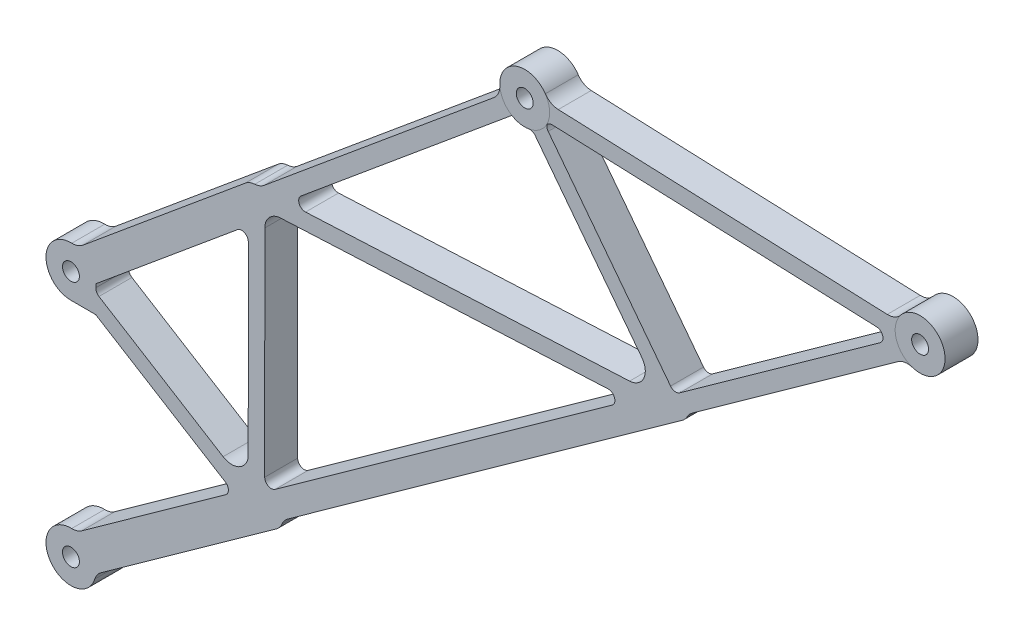
from build123d import *

# Parameters (mm, degrees)
SKETCH1_R           = 3.2639
BOSS_EXTRUDE1_DEPTH = 6.35
FILLET2_R           = 6.35
FILLET3_R           = 2.54
FILLET6_R           = 6.35
FILLET7_R           = 6.35


with BuildPart() as part:
    # Sketch1 → Boss-Extrude1 (new, symmetric)
    with BuildSketch(Plane.XY):
        with BuildLine():
            ThreePointArc((1657.362226857, -25.665303386), (1645.082138382, -19.376819434), (1639.161234094, -31.838299916))
            Line((1639.161234094, -31.838299916), (1543.928298612, -110.961407638))
            Line((1543.928298612, -110.961407638), (1542.386268966, -109.105413681))
            Line((1542.386268966, -109.105413681), (1475.716388889, -164.497259751))
            ThreePointArc((1475.716388889, -164.497259751), (1463.735668917, -172.561408735), (1473.270132637, -183.40862734))
            Line((1473.270132637, -183.40862734), (1482.795132637, -183.40862734))
            Line((1482.795132637, -183.40862734), (1536.006430236, -216.269775409))
            Line((1536.006430236, -216.269775409), (1475.438186342, -259.678478553))
            ThreePointArc((1475.438186342, -259.678478553), (1465.455879345, -274.64513078), (1482.83634148, -270.00113812))
            Line((1482.83634148, -270.00113812), (1554.239311773, -218.827286252))
            Line((1554.239311773, -218.827286252), (1553.129588502, -217.278887316))
            Line((1553.129588502, -217.278887316), (1710.323691942, -104.61931964))
            Line((1710.323691942, -104.61931964), (1709.583876428, -103.587053683))
            Line((1709.583876428, -103.587053683), (1795.041714347, -42.340207499))
            ThreePointArc((1795.041714347, -42.340207499), (1809.776954687, -31.712536315), (1791.625246623, -30.944293485))
            Line((1791.625246623, -30.944293485), (1657.362226857, -25.665303386))
        make_face()
        with BuildLine():
            Line((1700.720652168, -102.126820321), (1556.109252329, -109.096723899))
            Line((1556.109252329, -109.096723899), (1643.219206848, -36.72249454))
            ThreePointArc((1643.219206848, -36.72249454), (1647.101886478, -38.035715693), (1651.178708707, -37.612311142))
            Line((1651.178708707, -37.612311142), (1700.720652168, -102.126820321))
        make_face(mode=Mode.SUBTRACT)
        with BuildLine():
            ThreePointArc((1482.659265028, -175.861431519), (1482.859244436, -174.484660756), (1482.858420935, -173.093442291))
            Line((1482.858420935, -173.093442291), (1541.633109373, -124.261218638))
            Line((1541.633109373, -124.261218638), (1541.60005002, -212.260879574))
            Line((1541.60005002, -212.260879574), (1482.659265028, -175.861431519))
        make_face(mode=Mode.SUBTRACT)
        with Locations((1473.270132637, -269.04472734)):
            Circle(SKETCH1_R, mode=Mode.SUBTRACT)
        with Locations((1473.270132637, -173.79472734)):
            Circle(SKETCH1_R, mode=Mode.SUBTRACT)
        Polygon((1547.986271365, -115.845602263), (1688.873329523, -109.05520253), (1547.950879905, -210.053025619), align=None, mode=Mode.SUBTRACT)
        with Locations((1648.169999473, -28.481334088)):
            Circle(SKETCH1_R, mode=Mode.SUBTRACT)
        with BuildLine():
            Line((1705.884798859, -98.425723899), (1656.215061092, -33.744798419))
            ThreePointArc((1656.215061092, -33.744798419), (1656.708059099, -32.900452896), (1657.112748585, -32.010400752))
            Line((1657.112748585, -32.010400752), (1791.19818023, -37.282408394))
            Line((1791.19818023, -37.282408394), (1705.884798859, -98.425723899))
        make_face(mode=Mode.SUBTRACT)
        with Locations((1800.567995736, -34.473360149)):
            Circle(SKETCH1_R, mode=Mode.SUBTRACT)
    extrude(amount=BOSS_EXTRUDE1_DEPTH, both=True)

    # Fillet2
    fillet2_edges = [part.edges().sort_by_distance(p)[0] for p in [
        (1541.60005002, -212.260879574, 0),
        (1547.986271365, -115.845602263, 0),
        (1700.720652168, -102.126820321, 0),
        (1791.625246623, -30.944293485, 0),
        (1795.041714347, -42.340207499, 0),
        (1482.83634148, -270.00113812, 0),
        (1475.438186342, -259.678478553, 0),
        (1475.716388889, -164.497259751, 0),
        (1639.161234094, -31.838299916, 0),
        (1657.362226857, -25.665303386, 0),
    ]]
    fillet(fillet2_edges, radius=FILLET2_R)

    # Fillet3
    # the kernel refuses this fillet: 2.54 mm, written as the material it adds along each edge
    with BuildSketch(Plane(origin=(1482.659265028, -175.861431519, -6.35), x_dir=(0.8508312617816599, -0.5254390202250196, 0), z_dir=(0, 0, 1)), Plane(origin=(1656.215061092, -33.744798419, -6.35), x_dir=(0.6090571217254737, -0.7931263597154502, 0), z_dir=(0, 0, 1))) as fillet3_piece_1:
        with BuildLine():
            CenterArc((1.651924419, 2.54), FILLET3_R, 208.048541525, 61.951458475)
            ThreePointArc((-0.5897514, 1.345642633), (-0.269132792, 0.684103596), (0, 0))
            Line((0, 0), (1.651924419, 0))
        make_face()
    extrude(amount=12.7)
    with BuildSketch(Plane(origin=(1541.633109373, -124.261218638, -6.35), x_dir=(-0.00037567588921249087, -0.9999999294338106, 0), z_dir=(0, 0, 1))) as fillet3_piece_2:
        with BuildLine():
            CenterArc((FILLET3_R * 2.13199085195, -FILLET3_R), FILLET3_R, 90, 129.742603087)
            Line((FILLET3_R * 1.36306647439, -FILLET3_R * 1.63933973879), (0, 0))
            Line((0, 0), (FILLET3_R * 2.13199085195, 0))
        make_face()
    extrude(amount=12.7)
    with BuildSketch(Plane(origin=(1547.950879905, -210.053025619, 6.35), x_dir=(0.8128078399508512, 0.5825319006839296, 0), z_dir=(0, 0, -1))) as fillet3_piece_3:
        with BuildLine():
            CenterArc((FILLET3_R * 1.94789411365, -FILLET3_R), FILLET3_R, 90, 125.650345443)
            Line((FILLET3_R * 1.13530517425, -FILLET3_R * 1.58283721188), (0, 0))
            Line((0, 0), (FILLET3_R * 1.94789411365, 0))
        make_face()
    extrude(amount=12.7)
    with BuildSketch(Plane(origin=(1688.873329523, -109.05520253, -6.35), x_dir=(-0.9988405216590461, -0.04814158588875568, 0), z_dir=(0, 0, 1))) as fillet3_piece_4:
        with BuildLine():
            CenterArc((FILLET3_R * 3.39012199782, FILLET3_R), FILLET3_R, 122.869444547, 147.130555453)
            Line((FILLET3_R * 2.8473953887, FILLET3_R * 1.83990941639), (0, 0))
            Line((0, 0), (FILLET3_R * 3.39012199782, 0))
        make_face()
    extrude(amount=12.7)
    with BuildSketch(Plane(origin=(1705.884798859, -98.425723899, -6.35), x_dir=(-0.6090571217254714, 0.7931263597154518, 0), z_dir=(0, 0, 1))) as fillet3_piece_5:
        with BuildLine():
            CenterArc((FILLET3_R * 0.967502749894, -FILLET3_R), FILLET3_R, 90, 88.10746289)
            Line((-FILLET3_R * 0.0319517760986, -FILLET3_R * 0.966975002291), (0, 0))
            Line((0, 0), (FILLET3_R * 0.967502749894, 0))
        make_face()
    extrude(amount=12.7)
    with BuildSketch(Plane(origin=(1791.19818023, -37.282408394, 6.35), x_dir=(-0.9992279317494432, 0.03928791686676534, 0), z_dir=(0, 0, -1))) as fillet3_piece_6:
        with BuildLine():
            CenterArc((FILLET3_R * 2.91408494962, -FILLET3_R), FILLET3_R, 90, 142.119567883)
            Line((FILLET3_R * 2.30006927648, -FILLET3_R * 1.78929383194), (0, 0))
            Line((0, 0), (FILLET3_R * 2.91408494962, 0))
        make_face()
    extrude(amount=12.7)
    with BuildSketch(Plane(origin=(1657.112748585, -32.010400752, -6.35), x_dir=(-0.4370826010652276, -0.8994213694626424, 0), z_dir=(0, 0, 1))) as fillet3_piece_7:
        with BuildLine():
            CenterArc((1.663286591, 2.532574185), FILLET3_R, 203.666275918, 61.951458475)
            Line((-0.663096919, 1.512995956), (0, 0))
            ThreePointArc((0, 0), (0.734602071, 0.02810671), (1.469204142, 0))
        make_face()
    extrude(amount=12.7)
    with BuildSketch(Plane(origin=(1556.109252329, -109.096723899, 6.35), x_dir=(0.9988405216590459, 0.048141585888763216, 0), z_dir=(0, 0, -1))) as fillet3_piece_8:
        with BuildLine():
            CenterArc((FILLET3_R * 2.99200774925, -FILLET3_R), FILLET3_R, 90, 143.038297809)
            Line((FILLET3_R * 2.39072668673, -FILLET3_R * 1.79903759853), (0, 0))
            Line((0, 0), (FILLET3_R * 2.99200774925, 0))
        make_face()
    extrude(amount=12.7)
    with BuildSketch(Plane(origin=(1651.178708707, -37.612311142, -6.35), x_dir=(0.6090571217254943, -0.7931263597154341, 0), z_dir=(0, 0, 1))) as fillet3_piece_9:
        with BuildLine():
            CenterArc((1.651924419, -2.54), FILLET3_R, 90, 61.951458475)
            ThreePointArc((-0.5897514, -1.345642633), (-0.269132792, -0.684103596), (0, 0))
            Line((0, 0), (1.651924419, 0))
        make_face()
    extrude(amount=12.7)
    with BuildSketch(Plane(origin=(1536.006430236, -216.269775409, -6.35), x_dir=(-0.8508312617816903, 0.5254390202249702, 0), z_dir=(0, 0, 1))) as fillet3_piece_10:
        with BuildLine():
            CenterArc((FILLET3_R * 1.50151874055, FILLET3_R), FILLET3_R, 157.326623381, 112.673376619)
            Line((FILLET3_R * 0.578801433411, FILLET3_R * 1.38547732891), (0, 0))
            Line((0, 0), (FILLET3_R * 1.50151874055, 0))
        make_face()
    extrude(amount=12.7)

    # Fillet6
    # the kernel refuses this fillet: 6.35 mm, written as the material it adds along each edge
    with BuildSketch(Plane(origin=(1543.928298612, -110.961407638, -6.35), x_dir=(-0.6390508273261215, 0.7691645078224811, 0), z_dir=(0, 0, 1))) as fillet6_piece_1:
        with BuildLine():
            CenterArc((6.35, -4.982221492), FILLET6_R, 128.316134474, 51.683865526)
            Line((0, -4.982221492), (-0.127, -4.982221492))
            Line((-0.127, -4.982221492), (-0.127, 0))
            Line((-0.127, 0), (0, 0.127))
            ThreePointArc((0, 0.127), (1.2065, 0.127), (2.33426, 0.09964443))
            Line((2.33426, 0.09964443), (2.413, 0))
        make_face()
    extrude(amount=12.7)
    with BuildSketch(Plane(origin=(1709.583876428, -103.587053683, 6.35), x_dir=(0.8128078399508694, 0.582531900683904, 0), z_dir=(0, 0, -1))) as fillet6_piece_2:
        with BuildLine():
            CenterArc((3.81, 6.35), FILLET6_R, 233.130102354, 36.869897646)
            Line((0, 1.27), (-0.0762, 1.1684))
            ThreePointArc((-0.0762, 1.1684), (-0.127, 0.635), (-0.127, 0))
            Line((-0.127, 0), (0, -0.127))
            Line((0, -0.127), (3.81, -0.127))
            Line((3.81, -0.127), (3.81, 0))
        make_face()
    extrude(amount=12.7)
    with BuildSketch(Plane(origin=(1553.129588502, -217.278887316, -6.35), x_dir=(0.8128078399508519, 0.5825319006839285, 0), z_dir=(0, 0, 1))) as fillet6_piece_3:
        with BuildLine():
            CenterArc((4.534807052, -6.35), FILLET6_R, 90, 45.572995999)
            Line((0, -1.905), (-0.090696141, -1.8161))
            ThreePointArc((-0.090696141, -1.8161), (-0.127, -0.9525), (-0.127, 0))
            Line((-0.127, 0), (0, 0.127))
            Line((0, 0.127), (4.534807052, 0.127))
            Line((4.534807052, 0.127), (4.534807052, 0))
        make_face()
    extrude(amount=12.7)

    # Fillet7
    fillet7_edges = [part.edges().sort_by_distance(p)[0] for p in [
        (1710.323691942, -104.61931964, 0),
        (1554.239311773, -218.827286252, 0),
        (1542.386268966, -109.105413681, 0),
    ]]
    fillet(fillet7_edges, radius=FILLET7_R)


solid = part.part
